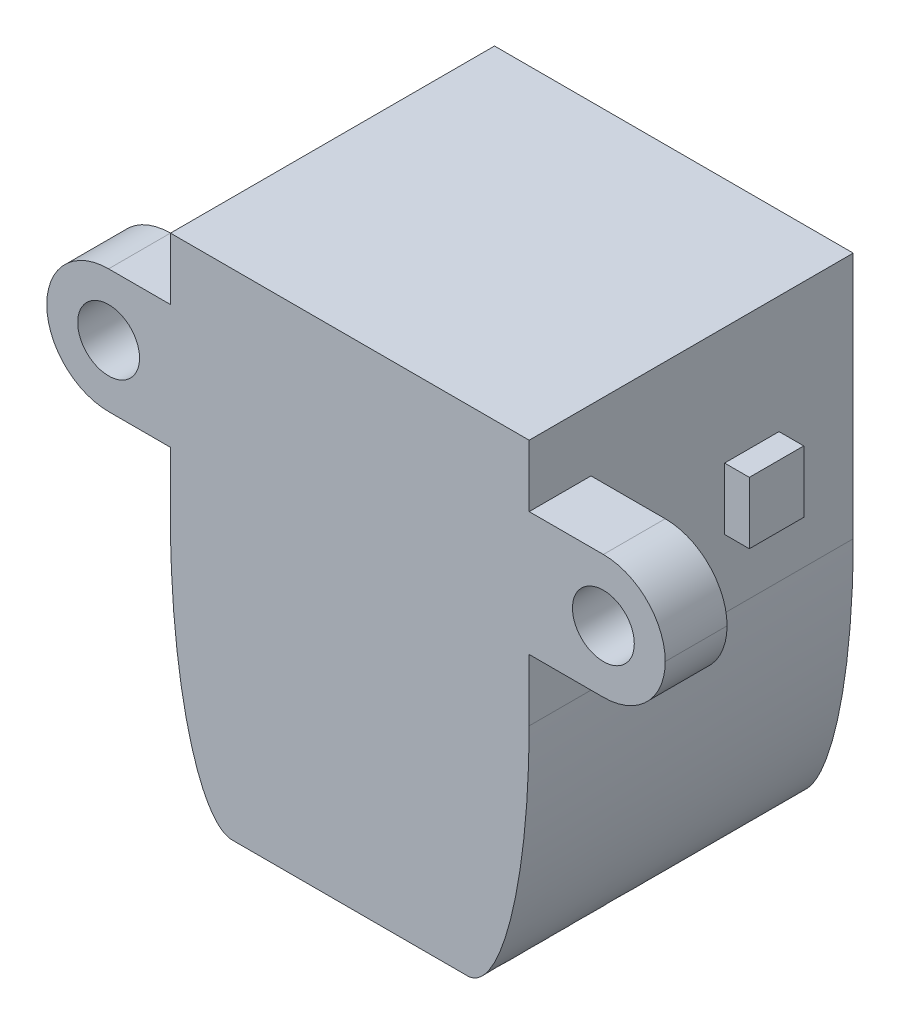
from build123d import *

# Parameters (mm, degrees)
SKETCH1_W                = 29
SKETCH1_H                = 40
BOSS_EXTRUDE1_DEPTH      = 26.2
FILLET1_SIZE             = 20
FILLET1_SIZE_2           = 5
BOSS_EXTRUDE2_DEPTH      = 10
BOSS_EXTRUDE2_DEPTH_BACK = 40
SKETCH5_W                = 5
SKETCH5_H                = 10
FILLET2_R                = 5
SKETCH6_R                = 2.5
CUT_EXTRUDE2_DEPTH       = 6
BOSS_EXTRUDE3_DEPTH      = 2
BOSS_EXTRUDE3_DEPTH_BACK = 31


# Some blends are built 0.0001 mm under size
with BuildPart() as part:
    # Sketch1 → Boss-Extrude1 (new body)
    with BuildSketch(Plane.XY):
        with Locations((14.5, -20)):
            Rectangle(SKETCH1_W, SKETCH1_H)
    extrude(amount=BOSS_EXTRUDE1_DEPTH)

    # Fillet1
    # an asymmetric fillet: 20, 5 mm, written as the material it takes off along each edge
    with BuildSketch(Plane(origin=(29, -40, -50), x_dir=(0, 1, 0), z_dir=(0, 0, 1))) as fillet1_piece_1:
        with BuildLine():
            Bezier((FILLET1_SIZE, 0), (0, 0), (0, FILLET1_SIZE_2), weights=[1, 0.707106781, 1])
            Line((0, FILLET1_SIZE_2), (0, 0))
            Line((0, 0), (FILLET1_SIZE, 0))
        make_face()
    extrude(amount=126.2, mode=Mode.SUBTRACT)
    with BuildSketch(Plane(origin=(0, -40, -50), x_dir=(1, 0, 0), z_dir=(0, 0, 1))) as fillet1_piece_2:
        with BuildLine():
            Bezier((FILLET1_SIZE_2, 0), (0, 0), (0, FILLET1_SIZE), weights=[1, 0.707106781, 1])
            Line((0, FILLET1_SIZE), (0, 0))
            Line((0, 0), (FILLET1_SIZE_2, 0))
        make_face()
    extrude(amount=126.2, mode=Mode.SUBTRACT)

    # Sketch5 → Boss-Extrude2 (add, two sides: drawn at the far end of the back side and taken through both)
    with BuildSketch(Plane.ZY.offset(-BOSS_EXTRUDE2_DEPTH_BACK)):
        with Locations((23.7, -10)):
            Rectangle(SKETCH5_W, SKETCH5_H)
    extrude(amount=BOSS_EXTRUDE2_DEPTH + BOSS_EXTRUDE2_DEPTH_BACK)

    # Fillet2
    fillet2_edges = [part.edges().sort_by_distance(p)[0] for p in [
        (40, -15, 23.7),
        (40, -5, 23.7),
        (-10, -15, 23.7),
        (-10, -5, 23.7),
    ]]
    fillet(fillet2_edges, radius=FILLET2_R - 0.0001)  # a hair under: the kernel refuses the full size

    # Sketch6 → Cut-Extrude2 (cut)
    with BuildSketch(Plane.XY.offset(26.2)):
        with Locations((-5, -10)):
            Circle(SKETCH6_R)
        with Locations((35, -10)):
            Circle(SKETCH6_R)
    extrude(amount=-CUT_EXTRUDE2_DEPTH, mode=Mode.SUBTRACT)

    # Sketch7 → Boss-Extrude3 (add, two sides: drawn at the far end of the back side and taken through both)
    with BuildSketch(Plane(origin=(29, 0, 0), x_dir=(0, 0, -1), z_dir=(1, 0, 0)).offset(-BOSS_EXTRUDE3_DEPTH_BACK)):
        Polygon((-8.2, -9.5), (-6, -9.5), (-6, -12), (-6, -14.5), (-8.2, -14.5), (-10.4, -14.5), (-10.4, -12), (-10.4, -9.5), align=None)
    extrude(amount=BOSS_EXTRUDE3_DEPTH + BOSS_EXTRUDE3_DEPTH_BACK)


solid = part.part
